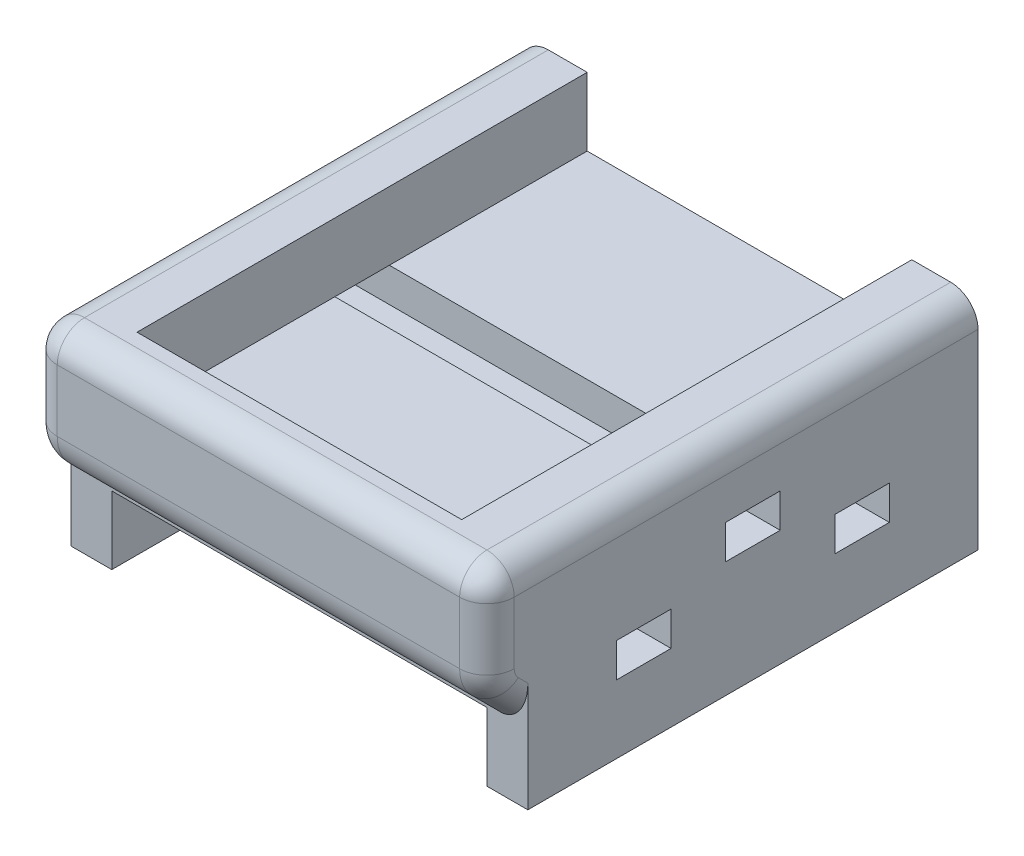
from build123d import *

# Parameters (mm, degrees)
BOSS_EXTRU_1_DEPTH      = 33
ESQUISSE2_W             = 4
ESQUISSE2_H             = 2.5
ENL_V_MAT_EXTRU_1_DEPTH = 48.736346803
ESQUISSE3_W             = 4
ESQUISSE3_H             = 2.5
ENL_V_MAT_EXTRU_2_DEPTH = 48.736346803
ESQUISSE4_W             = 33.5
ESQUISSE4_H             = 7.783625731
BOSS_EXTRU_2_DEPTH      = 3
CHANFREIN1_SIZE         = 3
CONG_3_START            = -18
CONG_3_DEPTH            = 36
CONG_2_R                = 2


with BuildPart() as part:
    # Esquisse1 → Boss.-Extru.1 (new body)
    with BuildSketch(Plane.XY):
        Polygon((-11.9, 2.783625731), (11.9, 2.783625731), (11.9, 7.783625731), (16.75, 7.783625731), (16.75, -8.216374269), (13.75, -8.216374269), (13.75, -3.216374269), (-13.75, -3.216374269), (-13.75, -8.216374269), (-16.75, -8.216374269), (-16.75, 7.783625731), (-11.9, 7.783625731), align=None)
    extrude(amount=BOSS_EXTRU_1_DEPTH)

    # Esquisse2 → Enlèv. mat.-Extru.1 (cut, through all)
    with BuildSketch(Plane(origin=(16.75, 0, 0), x_dir=(0, 0, -1), z_dir=(1, 0, 0))):
        with Locations((-24.5, -1.966374269)):
            Rectangle(ESQUISSE2_W, ESQUISSE2_H)
        with Locations((-8.5, -1.966374269)):
            Rectangle(ESQUISSE2_W, ESQUISSE2_H)
    extrude(amount=-ENL_V_MAT_EXTRU_1_DEPTH, mode=Mode.SUBTRACT)

    # Esquisse3 → Enlèv. mat.-Extru.2 (cut, through all)
    with BuildSketch(Plane(origin=(16.75, 0, 0), x_dir=(0, 0, -1), z_dir=(1, 0, 0))):
        with Locations((-16.5, 1.533625731)):
            Rectangle(ESQUISSE3_W, ESQUISSE3_H)
    extrude(amount=-ENL_V_MAT_EXTRU_2_DEPTH, mode=Mode.SUBTRACT)

    # Esquisse4 → Boss.-Extru.2 (add)
    with BuildSketch(Plane.XY.offset(33)):
        with Locations((0, 3.891812866)):
            Rectangle(ESQUISSE4_W, ESQUISSE4_H)
    extrude(amount=BOSS_EXTRU_2_DEPTH)

    # Chanfrein1
    chanfrein1_edges = [part.edges().sort_by_distance(p)[0] for p in [
        (0, 0, 33),
    ]]
    chamfer(chanfrein1_edges, length=CHANFREIN1_SIZE - 0.0001)  # a hair under: the kernel refuses the full size

    # Congé3: read off the stored shape, not the designer's step
    # Congé3 outline → Congé3 (cut)
    with BuildSketch(Plane.YZ.offset(CONG_3_START)):
        with BuildLine():
            Line((0, 36), (-0.878679656, 35.121320344))
            ThreePointArc((-0.878679656, 35.121320344), (0.09459039, 35.771638598), (1.242640687, 36))
            Line((1.242640687, 36), (0, 36))
        make_face()
    extrude(amount=CONG_3_DEPTH, mode=Mode.SUBTRACT)

    # Congé2
    cong_2_edges = [part.edges().sort_by_distance(p)[0] for p in [
        (0, 7.783625731, 36),
        (-16.75, -1.931982494, 34.067917506),
        (16.75, 4.513133209, 36),
        (16.75, -1.931982494, 34.067917506),
        (16.75, 0.104112039, 35.77556346),
        (-16.75, 0.104112039, 35.77556346),
        (16.75, 7.783625731, 18),
        (-16.75, 7.783625731, 18),
        (-16.75, 4.513133209, 36),
    ]]
    fillet(cong_2_edges, radius=CONG_2_R)


solid = part.part
